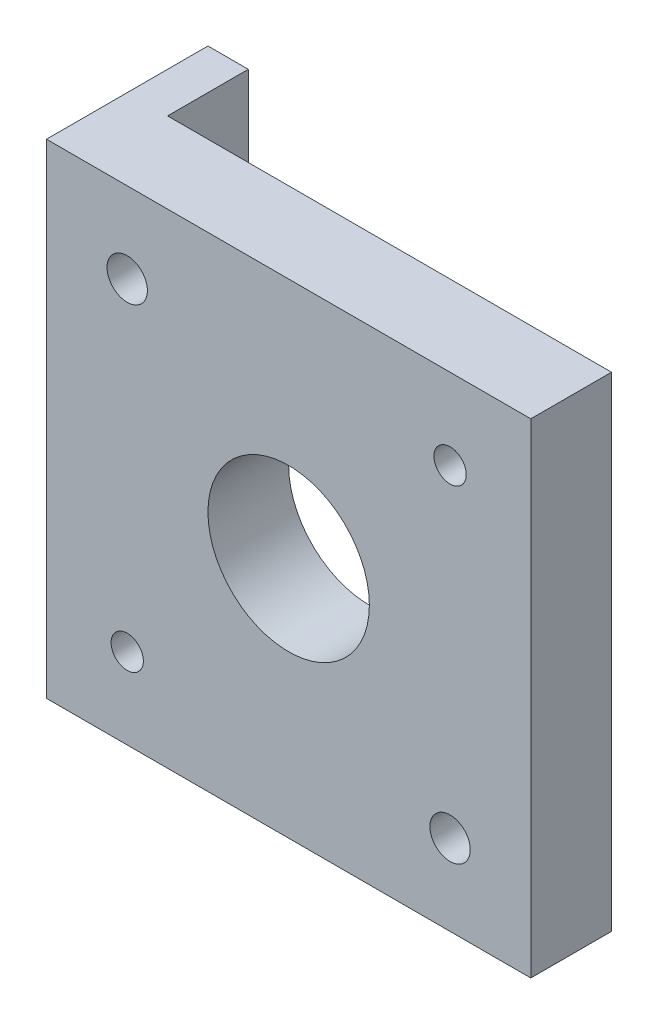
from build123d import *

# Parameters (mm, degrees)
SKETCH1_W           = 60
SKETCH1_H           = 60
BOSS_EXTRUDE1_DEPTH = 10
SKETCH4_W           = 5
SKETCH4_H           = 60
BOSS_EXTRUDE2_DEPTH = 10
SKETCH5_R           = 2
CUT_EXTRUDE3_DEPTH  = 86.440037453
SKETCH2_R           = 10
CUT_EXTRUDE5_DEPTH  = 86.440037453
CAVITY1_OUTLINE_R   = 2.5
CAVITY1_DEPTH       = 10
SKETCH7_R           = 2
CUT_EXTRUDE6_DEPTH  = 88.177978871


# Read off the part's stored shape, not the designer's step: Cavity1
with BuildPart() as part:
    # Sketch1 → Boss-Extrude1 (new body)
    with BuildSketch(Plane.XY):
        with Locations((30, 30)):
            Rectangle(SKETCH1_W, SKETCH1_H)
    extrude(amount=BOSS_EXTRUDE1_DEPTH)

    # Sketch4 → Boss-Extrude2 (add)
    with BuildSketch(Plane(origin=(0, 0, 0), x_dir=(-1, 0, 0), z_dir=(0, 0, -1))):
        with Locations((-2.5, 30)):
            Rectangle(SKETCH4_W, SKETCH4_H)
    extrude(amount=BOSS_EXTRUDE2_DEPTH)

    # Sketch5 → Cut-Extrude3 (cut, through all)
    with BuildSketch(Plane.ZY):
        with Locations((-6, 50)):
            Circle(SKETCH5_R)
        with Locations((-6, 10)):
            Circle(SKETCH5_R)
    extrude(amount=-CUT_EXTRUDE3_DEPTH, mode=Mode.SUBTRACT)

    # Sketch2 → Cut-Extrude5 (cut, through all)
    with BuildSketch(Plane(origin=(0, 0, 0), x_dir=(-1, 0, 0), z_dir=(0, 0, -1))):
        with Locations((-30, 30)):
            Circle(SKETCH2_R)
    extrude(amount=-CUT_EXTRUDE5_DEPTH, mode=Mode.SUBTRACT)

    # Cavity1 outline → Cavity1 (cut)
    with BuildSketch(Plane.XY):
        with Locations((10, 50)):
            Circle(CAVITY1_OUTLINE_R)
        with Locations((50, 10)):
            Circle(CAVITY1_OUTLINE_R)
    extrude(amount=CAVITY1_DEPTH, mode=Mode.SUBTRACT)

    # Sketch7 → Cut-Extrude6 (cut, through all)
    with BuildSketch(Plane.XY.offset(10)):
        with Locations((50, 50)):
            Circle(SKETCH7_R)
        with Locations((10, 10)):
            Circle(SKETCH7_R)
    extrude(amount=-CUT_EXTRUDE6_DEPTH, mode=Mode.SUBTRACT)


solid = part.part
